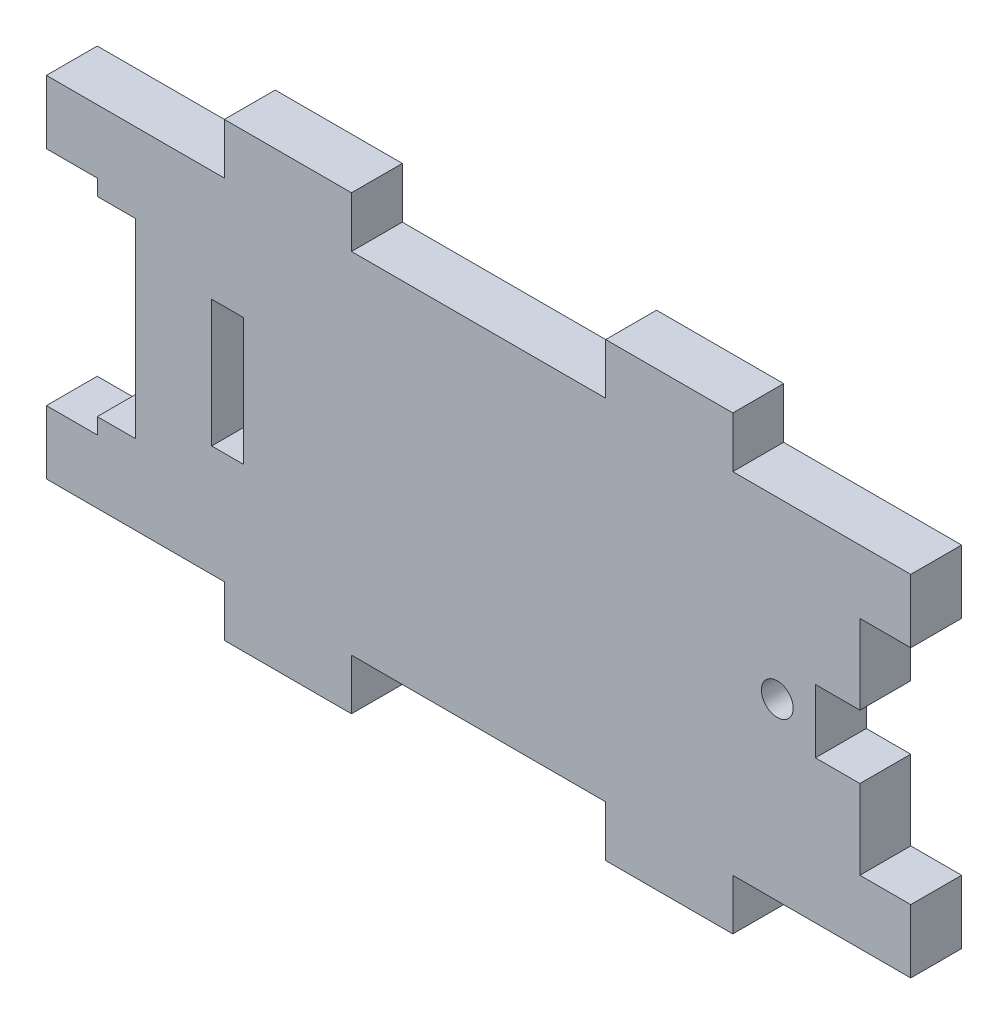
from build123d import *

# Parameters (mm, degrees)
SKETCH1_W           = 120
SKETCH1_H           = 55
SKETCH1_R           = 2.5
SKETCH1_W_2         = 5
SKETCH1_H_2         = 20
BOSS_EXTRUDE1_DEPTH = 8
CUT_EXTRUDE1_REACH  = 68.485
SKETCH2_W           = 38.750815327
SKETCH2_H           = 30
SKETCH4_W           = 8
SKETCH4_H           = 10
BOSS_EXTRUDE3_DEPTH = 8
SKETCH6_W           = 20
SKETCH6_H           = 8
BOSS_EXTRUDE4_DEPTH = 8
SKETCH7_W           = 8
SKETCH7_H           = 10
CUT_EXTRUDE2_DEPTH  = 7


with BuildPart() as part:
    # Sketch1 → Boss-Extrude1 (new body)
    with BuildSketch(Plane.XY):
        Rectangle(SKETCH1_W, SKETCH1_H)
        with Locations((47, 0)):
            Circle(SKETCH1_R, mode=Mode.SUBTRACT)
        with Locations((-39.5, 0)):
            Rectangle(SKETCH1_W_2, SKETCH1_H_2, mode=Mode.SUBTRACT)
    extrude(amount=BOSS_EXTRUDE1_DEPTH)

    # Sketch2 → Cut-Extrude1 (cut, up to next)
    with BuildSketch(Plane.XY.offset(8), mode=Mode.PRIVATE) as cut_extrude1_sk1:
        with Locations((-73.375407663, 0)):
            Rectangle(SKETCH2_W, SKETCH2_H)
    cut_extrude1_tool1 = extrude(cut_extrude1_sk1.sketch, amount=-CUT_EXTRUDE1_REACH, mode=Mode.PRIVATE) & part.part
    add(cut_extrude1_tool1.solids().sort_by_distance((-73.375408, 0, 8))[0], mode=Mode.SUBTRACT)

    # Sketch4 → Boss-Extrude3 (add)
    with BuildSketch(Plane(origin=(60, 0, 0), x_dir=(0, 0, -1), z_dir=(1, 0, 0))):
        with Locations((-4, 22.5)):
            Rectangle(SKETCH4_W, SKETCH4_H)
        with Locations((-4, -22.5)):
            Rectangle(SKETCH4_W, SKETCH4_H)
    boss_extrude3 = extrude(amount=BOSS_EXTRUDE3_DEPTH)

    # Sketch6 → Boss-Extrude4 (add)
    with BuildSketch(Plane.XZ.offset(27.5)):
        with Locations((-30, 4)):
            Rectangle(SKETCH6_W, SKETCH6_H)
        with Locations((30, 4)):
            Rectangle(SKETCH6_W, SKETCH6_H)
    boss_extrude4 = extrude(amount=BOSS_EXTRUDE4_DEPTH)

    # Mirror2: Boss-Extrude4 across plane
    add(boss_extrude4.mirror(Plane(origin=(0, 0, 0), x_dir=(0, 0, 1), z_dir=(0, -1, 0))))

    # Mirror3: Boss-Extrude3 across plane
    add(boss_extrude3.mirror(Plane.ZY))

    # Sketch7 → Cut-Extrude2 (cut)
    with BuildSketch(Plane(origin=(60, 0, 0), x_dir=(0, 0, -1), z_dir=(1, 0, 0))):
        with Locations((-4, 0)):
            Rectangle(SKETCH7_W, SKETCH7_H)
    extrude(amount=-CUT_EXTRUDE2_DEPTH, mode=Mode.SUBTRACT)


solid = part.part
